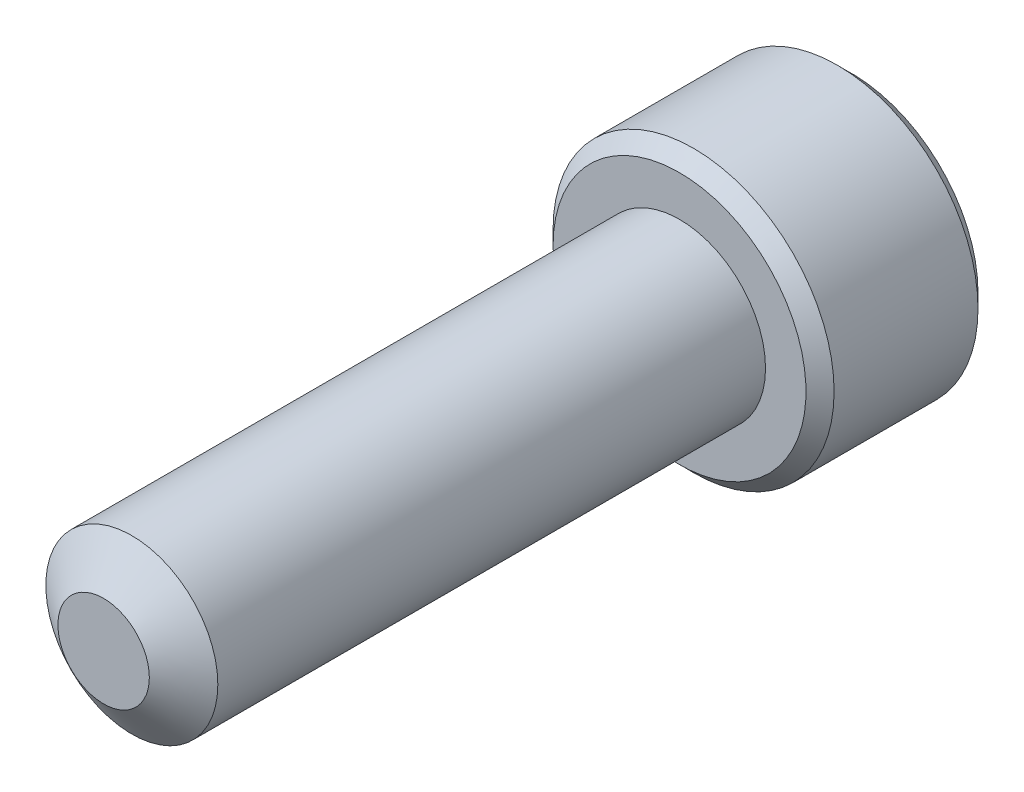
from build123d import *

# Parameters (mm, degrees)
SKETCH1_R          = 1.4224
EXTRUDE1_DEPTH     = 9.525
SKETCH6_R          = 2.3241
EXTRUDE2_DEPTH     = 2.8448
CUT_EXTRUDE1_DEPTH = 1.7859375
CHAMFER1_SIZE      = 0.23241


with BuildPart() as part:
    # Sketch1 → Extrude1 (new body)
    with BuildSketch(Plane.XY):
        Circle(SKETCH1_R)
    extrude(amount=-EXTRUDE1_DEPTH)

    # Sketch4 → Cut-Revolve1 (revolve, cut)
    with BuildSketch(Plane(origin=(0, 0, 0), x_dir=(0, 0, -1), z_dir=(1, 0, 0))):
        Polygon((0.466649532, 1.4224), (0, 0.755955401), (0, 1.4224), align=None)
    revolve(axis=Axis((0, 0, 0), (0, 0, -1)), mode=Mode.SUBTRACT)

    # Sketch6 → Extrude2 (add)
    with BuildSketch(Plane(origin=(0, 0, -9.525), x_dir=(-1, 0, 0), z_dir=(0, 0, -1))):
        Circle(SKETCH6_R)
    extrude(amount=EXTRUDE2_DEPTH)

    # Sketch7 → Cut-Extrude1 (cut)
    with BuildSketch(Plane(origin=(0, 0, -12.3698), x_dir=(-1, 0, 0), z_dir=(0, 0, -1))):
        Polygon((0, 1.374815329), (-1.190625, 0.687407664), (-1.190625, -0.687407664), (0, -1.374815329), (1.190625, -0.687407664), (1.190625, 0.687407664), align=None)
    extrude(amount=-CUT_EXTRUDE1_DEPTH, mode=Mode.SUBTRACT)

    # Cut-Extrude2 cone 1 section (through the dimple's axis) → Cut-Extrude2 (revolve, cut)
    with BuildSketch(Plane(origin=(0, 0, -12.3698), x_dir=(0, 1, 0), z_dir=(1, 0, 0))):
        Polygon((0, 0), (1.374815329, 0), (0, 1.374815329), align=None)
    revolve(axis=Axis((0, 0, -12.3698), (0, 0, 1)), mode=Mode.SUBTRACT)

    # Chamfer1
    chamfer1_edges = [part.edges().sort_by_distance(p)[0] for p in [
        (2.3241, 0, -12.3698),
        (2.3241, 0, -9.525),
    ]]
    chamfer(chamfer1_edges, length=CHAMFER1_SIZE)


solid = part.part
